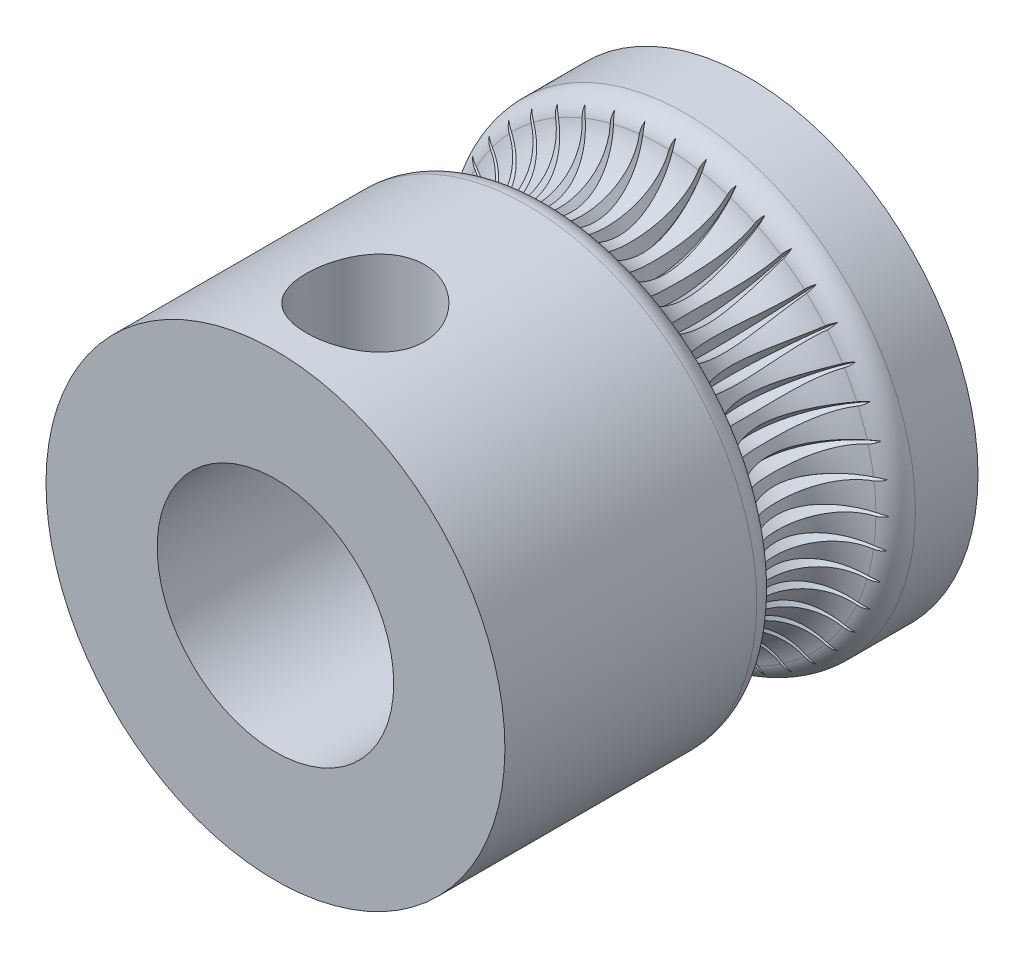
from build123d import *

# Parameters (mm, degrees)
EXTRUDE1_START    = 4
SKETCH1_R         = 4.85
EXTRUDE1_DEPTH    = 10
SKETCH2_R         = 2.5
EXTRUDE2_DEPTH    = 15.6
SKETCH3_R         = 1.25
EXTRUDE3_DEPTH    = 15.6
SKETCH5_R         = 1.25
CIRPATTERN2_COUNT = 45


with BuildPart() as part:
    # Sketch1 → Extrude1 (new body)
    with BuildSketch(Plane.XY.offset(EXTRUDE1_START)):
        Circle(SKETCH1_R)
    extrude(amount=EXTRUDE1_DEPTH)

    # Sketch2 → Extrude2 (cut)
    with BuildSketch(Plane.XY.offset(14)):
        Circle(SKETCH2_R)
    extrude(amount=-EXTRUDE2_DEPTH, mode=Mode.SUBTRACT)

    # Sketch3 → Extrude3 (cut)
    with BuildSketch(Plane(origin=(0, 0, 0), x_dir=(1, 0, 0), z_dir=(0, 1, 0))):
        with Locations(Location((0, -12.1, 0), (0, 0, 90))):
            Circle(SKETCH3_R)
    extrude(amount=EXTRUDE3_DEPTH, mode=Mode.SUBTRACT)

    # Cut-Sweep1: sweep along a path in Sketch4
    with BuildLine(Plane.XY.offset(7)) as cut_sweep1_path:
        CenterArc((0, 0), 4.85, 0, 360)
    # Sketch5 → Cut-Sweep1 (sweep, cut)
    with BuildSketch(Plane(origin=(0, 0, 0), x_dir=(1, 0, 0), z_dir=(0, 1, 0))):
        with Locations((4.85, -7)):
            Circle(SKETCH5_R)
    sweep(path=cut_sweep1_path.line, mode=Mode.SUBTRACT)

    # Cut-Sweep2: sweep along a path in Sketch7
    with BuildLine(Plane(origin=(0, 0, 0), x_dir=(1, 0, 0), z_dir=(0, 1, 0))) as cut_sweep2_path:
        EllipticalCenterArc((5.029053733, -7.011770723), 1.429102208, 1.088861664, start_angle=0, arc_size=360, rotation=179.528081082)
    # Sketch8 → Cut-Sweep2 (sweep, cut)
    with BuildSketch(Plane.XY.offset(7)):
        Polygon((3.35, 0), (3.981661307, -0.364689826), (3.981661307, 0.364689826), align=None)
    cut_sweep2 = sweep(path=cut_sweep2_path.line, mode=Mode.SUBTRACT)

    # Fillet1: read off the stored shape, not the designer's step
    # Fillet1 outline → Fillet1 (revolve, cut)
    with BuildSketch(Plane.XZ):
        with BuildLine():
            ThreePointArc((4.85, 8.677050983), (4.750891863, 8.37824383), (4.492857142, 8.197893559))
            Line((4.492857142, 8.197893559), (4.85, 8.197893559))
            Line((4.85, 8.197893559), (4.85, 8.677050983))
        make_face()
        with BuildLine():
            Line((4.85, 5.802106441), (4.492857143, 5.802106441))
            ThreePointArc((4.492857143, 5.802106441), (4.750891863, 5.621756169), (4.85, 5.322949017))
            Line((4.85, 5.322949017), (4.85, 5.802106441))
        make_face()
    revolve(axis=Axis((0, 0, 0), (0, 0, 1)), mode=Mode.SUBTRACT)

    # CirPattern2: Cut-Sweep2 ×45 about axis
    cirpattern2_axis = Axis((0, 0, 5.802106441), (0, 0, 1))
    for i in range(1, CIRPATTERN2_COUNT):
        add(cut_sweep2.rotate(cirpattern2_axis, i * 360 / CIRPATTERN2_COUNT), mode=Mode.SUBTRACT)


solid = part.part
